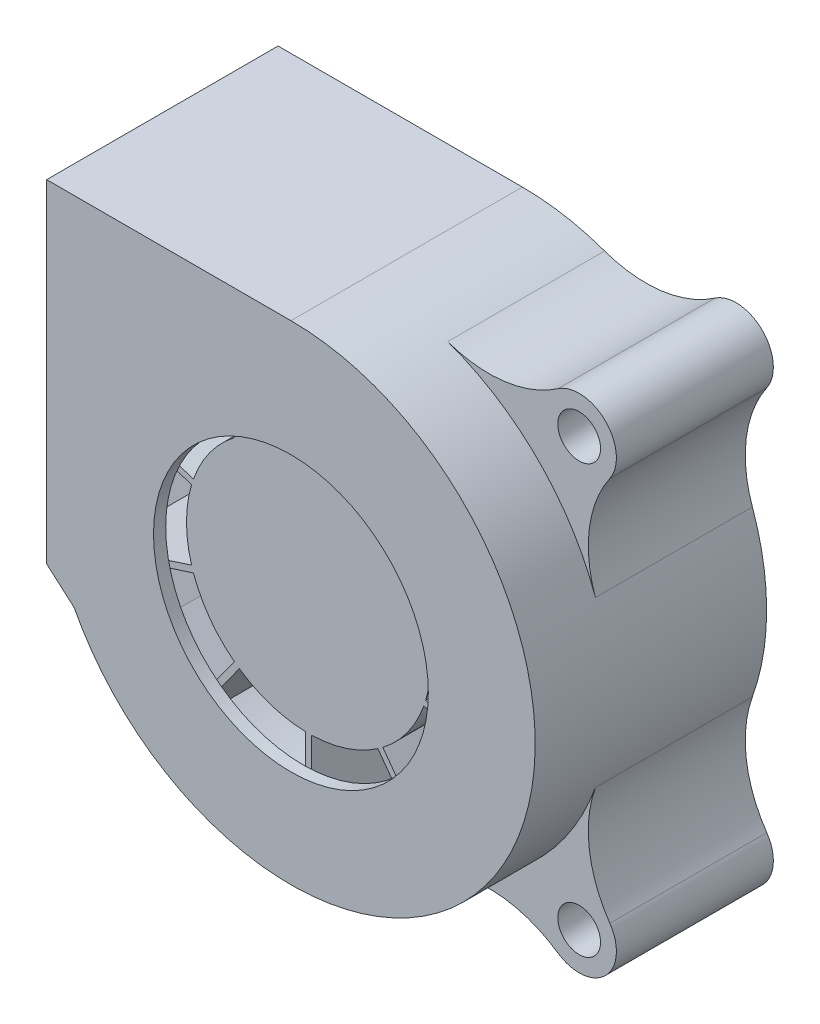
from build123d import *

# Parameters (mm, degrees)
CROQUIS1_R              = 1.75
SALIENTE_EXTRUIR1_DEPTH = 18.95
CROQUIS2_R              = 11.25
CORTAR_EXTRUIR1_DEPTH   = 15.95
CORTAR_EXTRUIR2_DEPTH   = 16.95
REDONDEO1_R             = 10
CORTAR_EXTRUIR3_START   = -6.1
CROQUIS4_R              = 1.75
CORTAR_EXTRUIR3_DEPTH   = 6.1
CORTAR_EXTRUIR4_REACH   = 36.694
CROQUIS7_W              = 4.5
CROQUIS7_H              = 3.5
SALIENTE_EXTRUIR2_START = 0.5
SALIENTE_EXTRUIR2_DEPTH = 16
MATRIZC1_COUNT          = 10


with BuildPart() as part:
    # Croquis1 → Saliente-Extruir1 (new body)
    with BuildSketch(Plane.XY):
        with BuildLine():
            Line((0, 20), (-20, 20))
            Line((-20, 20), (-20, -7.25))
            Line((-20, -7.25), (-16.161775697, -11.848424332))
            Line((-16.161775697, -11.848424332), (-19.656675683, -15.343324317))
            ThreePointArc((-19.656675683, -15.343324317), (-19.656675683, -19.656675683), (-15.343324317, -19.656675683))
            Line((-15.343324317, -19.656675683), (-11.820046036, -16.133397401))
            ThreePointArc((-11.820046036, -16.133397401), (0, -20), (11.820046036, -16.133397401))
            Line((11.820046036, -16.133397401), (15.343324317, -19.656675683))
            ThreePointArc((15.343324317, -19.656675683), (19.656675683, -19.656675683), (19.656675683, -15.343324317))
            Line((19.656675683, -15.343324317), (16.133397401, -11.820046036))
            ThreePointArc((16.133397401, -11.820046036), (20, 0), (16.133397401, 11.820046036))
            Line((16.133397401, 11.820046036), (19.656675683, 15.343324317))
            ThreePointArc((19.656675683, 15.343324317), (19.656675683, 19.656675683), (15.343324317, 19.656675683))
            Line((15.343324317, 19.656675683), (11.820046036, 16.133397401))
            ThreePointArc((11.820046036, 16.133397401), (6.218201186, 19.008786758), (0, 20))
        make_face()
        with Locations((17.5, 17.5)):
            Circle(CROQUIS1_R, mode=Mode.SUBTRACT)
        with Locations((17.5, -17.5)):
            Circle(CROQUIS1_R, mode=Mode.SUBTRACT)
        with Locations((-17.5, -17.5)):
            Circle(CROQUIS1_R, mode=Mode.SUBTRACT)
    extrude(amount=SALIENTE_EXTRUIR1_DEPTH)

    # Croquis2 → Cortar-Extruir1 (cut)
    with BuildSketch(Plane.XY.offset(18.95)):
        with Locations((0, -0.75)):
            Circle(CROQUIS2_R)
    extrude(amount=-CORTAR_EXTRUIR1_DEPTH, mode=Mode.SUBTRACT)

    # Croquis3 → Cortar-Extruir2 (cut)
    with BuildSketch(Plane.XY.offset(17.95)):
        with BuildLine():
            Line((-20, 19), (-20, -5.689439655))
            Line((-20, -5.689439655), (-15.394064055, -11.207628862))
            Line((-15.394064055, -11.207628862), (-11.229043734, -15.326727531))
            ThreePointArc((-11.229043734, -15.326727531), (0, -19), (11.229043734, -15.326727531))
            Line((11.229043734, -15.326727531), (15.326727531, -11.229043734))
            ThreePointArc((15.326727531, -11.229043734), (19, 0), (15.326727531, 11.229043734))
            Line((15.326727531, 11.229043734), (11.229043734, 15.326727531))
            ThreePointArc((11.229043734, 15.326727531), (5.907291127, 18.05834742), (0, 19))
            Line((0, 19), (-20, 19))
        make_face()
    extrude(amount=-CORTAR_EXTRUIR2_DEPTH, mode=Mode.SUBTRACT)

    # Redondeo1
    # the kernel refuses this fillet: 10 mm, written as the material it adds along each edge
    with BuildSketch(Plane(origin=(11.820046036, 16.133397401, 0), x_dir=(0.7135427704128318, 0.700611671892198, 0), z_dir=(0, 0, 1)), Plane(origin=(-11.820046036, -16.133397401, 0), x_dir=(-0.7135427704128318, -0.7006116718921981, 0), z_dir=(0, 0, 1)), Plane(origin=(16.133397401, -11.820046036, 0), x_dir=(0.700611671892198, -0.7135427704128318, 0), z_dir=(0, 0, 1))) as redondeo1_piece_1:
        with BuildLine():
            CenterArc((7.26065151, 9.850205373), REDONDEO1_R, 205.850666245, 54.219788289)
            Line((-1.738683967, 5.489934627), (-2.638617515, 5.053907553))
            ThreePointArc((-2.638617515, 5.053907553), (-1.624046999, 2.505949256), (-0.986867746, -0.161530343))
            Line((-0.986867746, -0.161530343), (0.009143667, -0.999958196))
            ThreePointArc((0.009143667, -0.999958196), (4.991603301, -0.954398337), (5.363843801, -0.985020537))
            Line((5.363843801, -0.985020537), (5.536280865, 0))
        make_face()
    extrude(amount=18.95)
    with BuildSketch(Plane(origin=(-16.161775697, -11.848424332, 0), x_dir=(-0.6407954702389175, 0.7677116420383924, 0), z_dir=(0, 0, 1))) as redondeo1_piece_2_section:
        with BuildLine():
            CenterArc((8.567409361, 9.662082083), REDONDEO1_R, 202.59121969, 52.471420127)
            Line((-0.665281617, 5.820543678), (-1.588550714, 5.436389838))
            ThreePointArc((-1.588550714, 5.436389838), (-1.439524257, 4.832848201), (-0.99596493, -0.089743286))
            Line((-0.99596493, -0.089743286), (0, -1))
            ThreePointArc((0, -1), (2.994890321, -1), (5.73201777, -0.966208208))
            Line((5.73201777, -0.966208208), (5.989780642, 0))
        make_face()
    redondeo1_piece_2 = extrude(amount=18.95, mode=Mode.PRIVATE)
    redondeo1_piece_2 = split(redondeo1_piece_2, bisect_by=Plane(origin=(-17.114557991, -9.506104322, 0.5), z_dir=(-0.7031762473130518, -0.7110155871812753, 0)), keep=Keep.TOP, mode=Mode.PRIVATE)
    add(redondeo1_piece_2)
    with BuildSketch(Plane(origin=(11.820046036, -16.133397401, 0), x_dir=(-0.8833512154109235, -0.4687116706804344, 0), z_dir=(0, 0, 1))) as redondeo1_piece_3:
        with BuildLine():
            CenterArc((7.198350956, 9.895824864), REDONDEO1_R, 207.502745576, 54.219788289)
            Line((-1.671536099, 5.277913687), (-2.558524804, 4.81612257))
            ThreePointArc((-2.558524804, 4.81612257), (-2.416943338, 4.470499368), (-0.956052835, -0.293194434))
            Line((-0.956052835, -0.293194434), (0.143967019, -0.989582486))
            ThreePointArc((0.143967019, -0.989582486), (2.879340382, -0.791649728), (5.614713746, -0.989582486))
            Line((5.614713746, -0.989582486), (5.758680765, 0))
        make_face()
    extrude(amount=18.95)
    with BuildSketch(Plane(origin=(16.133397401, 11.820046036, 0), x_dir=(0.7006116718921972, 0.7135427704128325, 0), z_dir=(0, 0, 1))) as redondeo1_piece_4:
        with BuildLine():
            CenterArc((7.26065151, -9.850205373), REDONDEO1_R, 99.929545466, 54.219788289)
            Line((-1.738683967, -5.489934627), (-2.638617515, -5.053907553))
            ThreePointArc((-2.638617515, -5.053907553), (-1.624046999, -2.505949256), (-0.986867746, 0.161530343))
            Line((-0.986867746, 0.161530343), (0.009143667, 0.999958196))
            ThreePointArc((0.009143667, 0.999958196), (4.991603301, 0.954398337), (5.363843801, 0.985020537))
            Line((5.363843801, 0.985020537), (5.536280865, 0))
        make_face()
    extrude(amount=18.95)

    # Croquis4 → Cortar-Extruir3 (cut)
    # profile 1 of 3: a face of its own
    with BuildSketch(Plane.XY.offset(18.95).offset(CORTAR_EXTRUIR3_START)):
        with BuildLine():
            Line((-17.751717357, -9.21284597), (-20, -7.25))
            ThreePointArc((-20, -7.25), (-19.072087099, -11.69323902), (-20.203965396, -16.088946798))
            ThreePointArc((-20.203965396, -16.088946798), (-19.521211718, -19.784119785), (-15.770419222, -20.012180394))
            ThreePointArc((-15.770419222, -20.012180394), (-11.393963282, -18.332951904), (-6.733108383, -18.832558283))
            ThreePointArc((-6.733108383, -18.832558283), (-13.153379381, -15.066141207), (-17.751717357, -9.21284597))
        make_face()
        with Locations((-17.5, -17.5)):
            Circle(CROQUIS4_R, mode=Mode.SUBTRACT)
    # profile 2 of 3: a face of its own
    with BuildSketch(Plane.XY.offset(18.95).offset(CORTAR_EXTRUIR3_START)):
        with BuildLine():
            ThreePointArc((18.832558283, -6.733108383), (14.142135624, -14.142135624), (6.733108383, -18.832558283))
            ThreePointArc((6.733108383, -18.832558283), (11.393963282, -18.332951904), (15.770419222, -20.012180394))
            ThreePointArc((15.770419222, -20.012180394), (19.656675683, -19.656675683), (20.012180394, -15.770419222))
            ThreePointArc((20.012180394, -15.770419222), (18.332951904, -11.393963282), (18.832558283, -6.733108383))
        make_face()
        with Locations((17.5, -17.5)):
            Circle(CROQUIS4_R, mode=Mode.SUBTRACT)
    # profile 3 of 3: a face of its own
    with BuildSketch(Plane.XY.offset(18.95).offset(CORTAR_EXTRUIR3_START)):
        with BuildLine():
            ThreePointArc((15.770419222, 20.012180394), (11.393963282, 18.332951904), (6.733108383, 18.832558283))
            ThreePointArc((6.733108383, 18.832558283), (14.142135624, 14.142135624), (18.832558283, 6.733108383))
            ThreePointArc((18.832558283, 6.733108383), (18.332951904, 11.393963282), (20.012180394, 15.770419222))
            ThreePointArc((20.012180394, 15.770419222), (19.656675683, 19.656675683), (15.770419222, 20.012180394))
        make_face()
        with Locations((17.5, 17.5)):
            Circle(CROQUIS4_R, mode=Mode.SUBTRACT)
    extrude(amount=CORTAR_EXTRUIR3_DEPTH, mode=Mode.SUBTRACT)

    # Croquis7 → Cortar-Extruir4 (cut, up to next)
    with BuildSketch(Plane(origin=(0, 0, 0), x_dir=(-1, 0, 0), z_dir=(0, 0, -1)), mode=Mode.PRIVATE) as cortar_extruir4_sk1:
        with Locations((0, -13.05)):
            Rectangle(CROQUIS7_W, CROQUIS7_H)
    cortar_extruir4_tool1 = extrude(cortar_extruir4_sk1.sketch, amount=-CORTAR_EXTRUIR4_REACH, mode=Mode.PRIVATE) & part.part
    add(cortar_extruir4_tool1.solids().sort_by_distance((0, -13.05, 0))[0], mode=Mode.SUBTRACT)


with BuildPart() as body_2:
    # Croquis8 → Saliente-Extruir2 (new body)
    with BuildSketch(Plane.XY.offset(1).offset(SALIENTE_EXTRUIR2_START)):
        with BuildLine():
            Line((-0.25, 17.998263805), (-0.25, 9.996874512))
            Line((-0.25, 9.996874512), (0, 0))
            Line((0, 0), (5.673761158, 8.234587684))
            ThreePointArc((5.673761158, 8.234587684), (3.090169944, 9.510565163), (0.25, 9.996874512))
            Line((0.25, 9.996874512), (0.25, 17.998263805))
            ThreePointArc((0.25, 17.998263805), (0, 18), (-0.25, 17.998263805))
        make_face()
    extrude(amount=SALIENTE_EXTRUIR2_DEPTH)


with BuildPart() as matrizc1_1:
    # MatrizC1: pattern copy
    add(body_2.part.rotate(Axis((0, 0, 0), (0, 0, 1)), 1 * 360 / MATRIZC1_COUNT))


with BuildPart() as matrizc1_2:
    # MatrizC1: pattern copy
    add(body_2.part.rotate(Axis((0, 0, 0), (0, 0, 1)), 2 * 360 / MATRIZC1_COUNT))


with BuildPart() as matrizc1_3:
    # MatrizC1: pattern copy
    add(body_2.part.rotate(Axis((0, 0, 0), (0, 0, 1)), 3 * 360 / MATRIZC1_COUNT))


with BuildPart() as matrizc1_4:
    # MatrizC1: pattern copy
    add(body_2.part.rotate(Axis((0, 0, 0), (0, 0, 1)), 4 * 360 / MATRIZC1_COUNT))


with BuildPart() as matrizc1_5:
    # MatrizC1: pattern copy
    add(body_2.part.rotate(Axis((0, 0, 0), (0, 0, 1)), 5 * 360 / MATRIZC1_COUNT))


with BuildPart() as matrizc1_6:
    # MatrizC1: pattern copy
    add(body_2.part.rotate(Axis((0, 0, 0), (0, 0, 1)), 6 * 360 / MATRIZC1_COUNT))


with BuildPart() as matrizc1_7:
    # MatrizC1: pattern copy
    add(body_2.part.rotate(Axis((0, 0, 0), (0, 0, 1)), 7 * 360 / MATRIZC1_COUNT))


with BuildPart() as matrizc1_8:
    # MatrizC1: pattern copy
    add(body_2.part.rotate(Axis((0, 0, 0), (0, 0, 1)), 8 * 360 / MATRIZC1_COUNT))


with BuildPart() as matrizc1_9:
    # MatrizC1: pattern copy
    add(body_2.part.rotate(Axis((0, 0, 0), (0, 0, 1)), 9 * 360 / MATRIZC1_COUNT))


with BuildPart() as matrizc1_1_1:
    add(matrizc1_1.part)

    # Combinar1: union body 2, MatrizC1_9, MatrizC1_8, MatrizC1_7, MatrizC1_6, MatrizC1_5, MatrizC1_4, MatrizC1_3, MatrizC1_2
    add(body_2.part)
    add(matrizc1_9.part)
    add(matrizc1_8.part)
    add(matrizc1_7.part)
    add(matrizc1_6.part)
    add(matrizc1_5.part)
    add(matrizc1_4.part)
    add(matrizc1_3.part)
    add(matrizc1_2.part)


solid = Compound([part.part, matrizc1_1_1.part])
